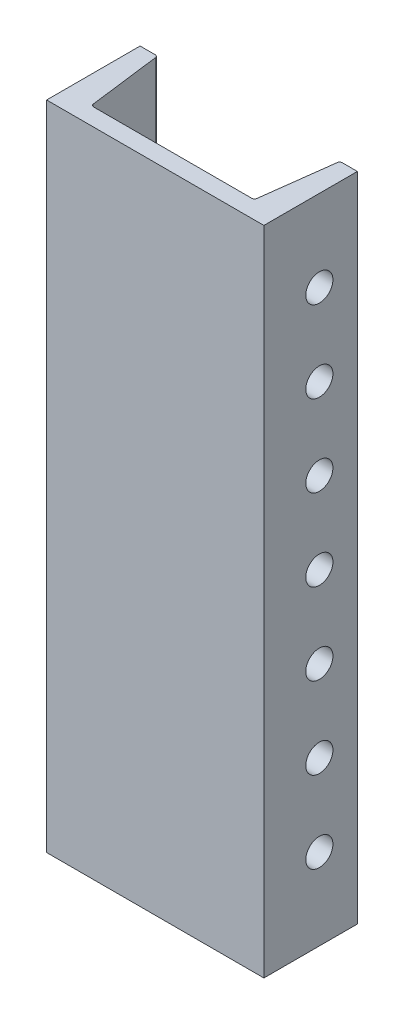
from build123d import *

# Parameters (mm, degrees)
BOSS_EXTRUDE1_DEPTH = 304.8
SKETCH2_R           = 6.35
CUT_EXTRUDE1_DEPTH  = 304.8
FILLET1_R           = 1.27


with BuildPart() as part:
    # Sketch1 → Boss-Extrude1 (new body)
    with BuildSketch(Plane(origin=(0, 0, 0), x_dir=(1, 0, 0), z_dir=(0, 1, 0))):
        Polygon((0, 0), (101.6, 0), (101.6, 43.7134), (93.4466, 43.7134), (88.9, 8.1534), (12.7, 8.1534), (8.1534, 43.7134), (0, 43.7134), align=None)
    extrude(amount=BOSS_EXTRUDE1_DEPTH)

    # Sketch2 → Cut-Extrude1 (cut)
    with BuildSketch(Plane(origin=(101.6, 0, 0), x_dir=(0, 0, -1), z_dir=(1, 0, 0))):
        with Locations((25.9334, 266.7)):
            Circle(SKETCH2_R)
        with Locations((25.9334, 152.4)):
            Circle(SKETCH2_R)
        with Locations((25.9334, 190.5)):
            Circle(SKETCH2_R)
        with Locations((25.9334, 228.6)):
            Circle(SKETCH2_R)
        with Locations((25.9334, 114.3)):
            Circle(SKETCH2_R)
        with Locations((25.9334, 76.2)):
            Circle(SKETCH2_R)
        with Locations((25.9334, 38.1)):
            Circle(SKETCH2_R)
    extrude(amount=-CUT_EXTRUDE1_DEPTH, mode=Mode.SUBTRACT)

    # Fillet1
    fillet1_edges = [part.edges().sort_by_distance(p)[0] for p in [
        (88.9, 152.4, -8.1534),
        (8.1534, 152.4, -43.7134),
        (93.4466, 152.4, -43.7134),
        (12.7, 152.4, -8.1534),
    ]]
    fillet(fillet1_edges, radius=FILLET1_R)


solid = part.part
